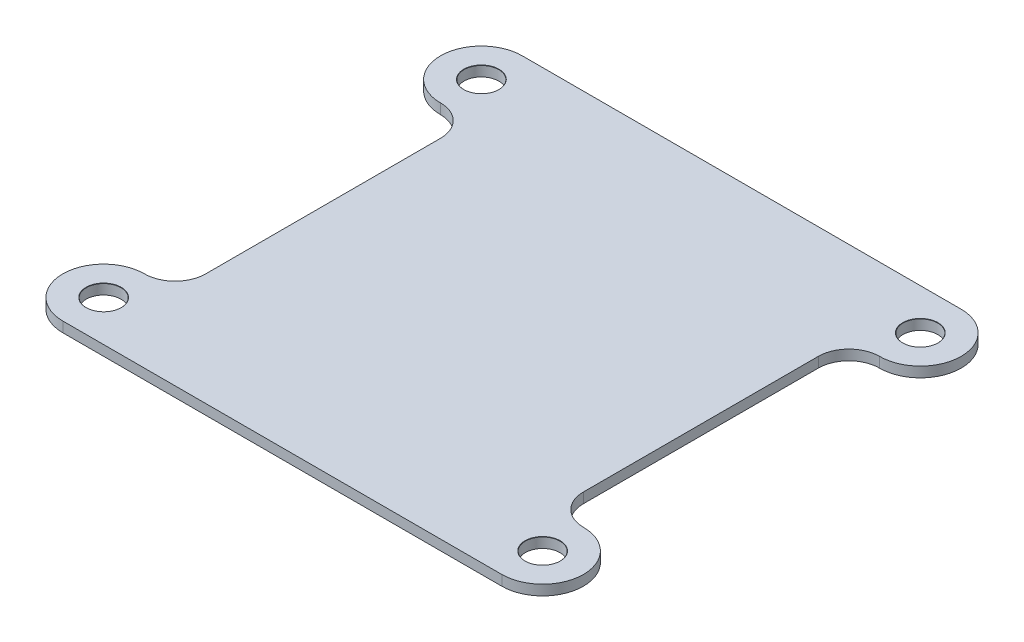
from build123d import *

# Parameters (mm, degrees)
SKETCH1_W                     = 37
SKETCH1_H                     = 45
BOSS_EXTRUDE1_DEPTH           = 1
BOSS_EXTRUDE2_DEPTH           = 1
FILLET1_R                     = 3
M3_CLEARANCE_HOLE1_AT_2_COUNT = 2
M3_CLEARANCE_HOLE1_AT_2_PITCH = 37
M3_CLEARANCE_HOLE1_AT_3_COUNT = 2
M3_CLEARANCE_HOLE1_AT_3_PITCH = 56.727418415
M3_CLEARANCE_HOLE1_AT_4_COUNT = 2
M3_CLEARANCE_HOLE1_AT_4_PITCH = 43


with BuildPart() as part:
    # Sketch1 → Boss-Extrude1 (new body)
    with BuildSketch(Plane(origin=(0, 0, 0), x_dir=(1, 0, 0), z_dir=(0, 1, 0))):
        Rectangle(SKETCH1_W, SKETCH1_H)
    extrude(amount=BOSS_EXTRUDE1_DEPTH)

    # Sketch2 → Boss-Extrude2 (add)
    with BuildSketch(Plane.XZ):
        with BuildLine():
            Line((21.5, 14.5), (-21.5, 14.5))
            ThreePointArc((-21.5, 14.5), (-25.5, 18.5), (-21.5, 22.5))
            Line((-21.5, 22.5), (21.5, 22.5))
            ThreePointArc((21.5, 22.5), (25.5, 18.5), (21.5, 14.5))
        make_face()
        with BuildLine():
            Line((21.5, -14.5), (-21.5, -14.5))
            ThreePointArc((-21.5, -14.5), (-25.5, -18.5), (-21.5, -22.5))
            Line((-21.5, -22.5), (21.5, -22.5))
            ThreePointArc((21.5, -22.5), (25.5, -18.5), (21.5, -14.5))
        make_face()
    extrude(amount=-BOSS_EXTRUDE2_DEPTH)

    # Fillet1
    fillet1_edges = [part.edges().sort_by_distance(p)[0] for p in [
        (-18.5, 0.5, 14.5),
        (-18.5, 0.5, -14.5),
        (18.5, 0.5, -14.5),
        (18.5, 0.5, 14.5),
    ]]
    fillet(fillet1_edges, radius=FILLET1_R - 0.0001)  # a hair under: the kernel refuses the full size

    # Sketch5 → M3 Clearance Hole1 (revolve, cut)
    with BuildSketch(Plane(origin=(-21.5, 1, -18.5), x_dir=(0, 0, 1), z_dir=(1, 0, 0))):
        Polygon((0, 0), (0, 1), (1.7, 1), (1.7, 0.025), (1.725, 0), align=None)
    m3_clearance_hole1 = revolve(axis=Axis((-21.5, 7.35, -18.5), (0, -1, 0)), mode=Mode.SUBTRACT)

    # M3 Clearance Hole1 at 2: M3 Clearance Hole1 ×2
    with Locations(*[(0, 0, i * M3_CLEARANCE_HOLE1_AT_2_PITCH) for i in range(1, M3_CLEARANCE_HOLE1_AT_2_COUNT)]):
        add(m3_clearance_hole1, mode=Mode.SUBTRACT)

    # M3 Clearance Hole1 at 3: M3 Clearance Hole1 ×2
    with Locations(*[Vector(0.7580108737829233, 0, 0.6522419146504225) * (i * M3_CLEARANCE_HOLE1_AT_3_PITCH) for i in range(1, M3_CLEARANCE_HOLE1_AT_3_COUNT)]):
        add(m3_clearance_hole1, mode=Mode.SUBTRACT)

    # M3 Clearance Hole1 at 4: M3 Clearance Hole1 ×2
    with Locations(*[(i * M3_CLEARANCE_HOLE1_AT_4_PITCH, 0, 0) for i in range(1, M3_CLEARANCE_HOLE1_AT_4_COUNT)]):
        add(m3_clearance_hole1, mode=Mode.SUBTRACT)


solid = part.part
